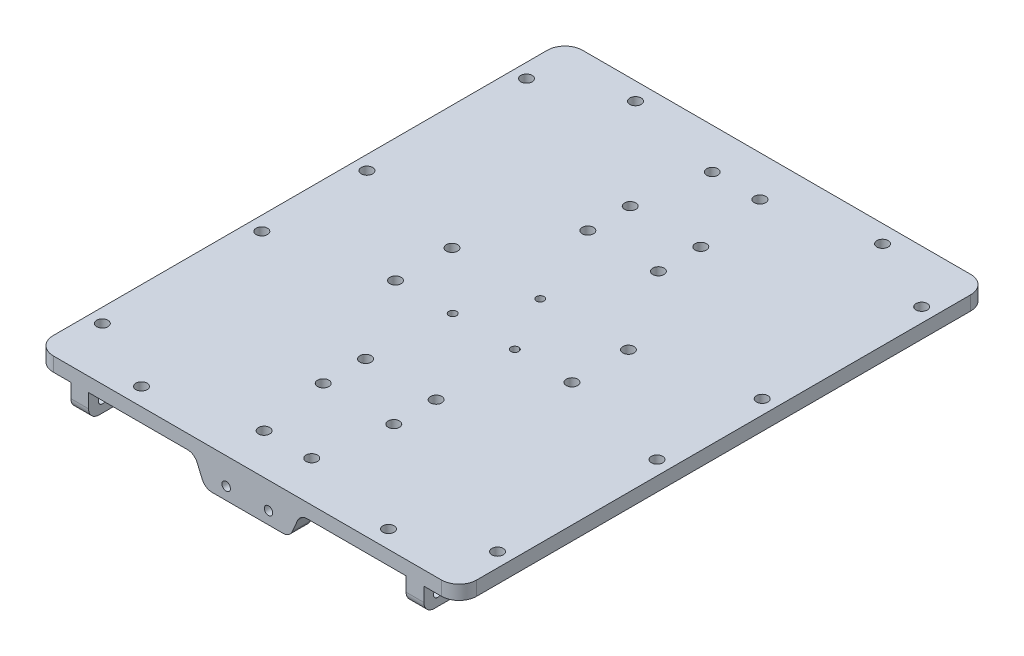
from build123d import *

# Parameters (mm, degrees)
SKETCH_1_W      = 120
SKETCH_1_H      = 150
SKETCH_1_R      = 1.6
SKETCH_1_R_2    = 1.1
EXTRUDE_1_DEPTH = 4
SKETCH_2_R      = 1.25
EXTRUDE_2_DEPTH = 5
SKETCH_3_R      = 1.2
EXTRUDE_3_DEPTH = 5
FILLET_1_R      = 5
FILLET_3_R      = 3


with BuildPart() as part:
    # 草图1 → 凸台-拉伸1 (new body)
    with BuildSketch(Plane(origin=(0, 0, 0), x_dir=(1, 0, 0), z_dir=(0, 1, 0))):
        Rectangle(SKETCH_1_W, SKETCH_1_H)
        with Locations((-56, 60.1)):
            Circle(SKETCH_1_R, mode=Mode.SUBTRACT)
        with Locations((-56, 14.9)):
            Circle(SKETCH_1_R, mode=Mode.SUBTRACT)
        with Locations((-10, 43.5)):
            Circle(SKETCH_1_R, mode=Mode.SUBTRACT)
        with Locations((-10, 31.5)):
            Circle(SKETCH_1_R, mode=Mode.SUBTRACT)
        with Locations((-56, -14.9)):
            Circle(SKETCH_1_R, mode=Mode.SUBTRACT)
        with Locations((-10, -31.5)):
            Circle(SKETCH_1_R, mode=Mode.SUBTRACT)
        with Locations((-10, -43.5)):
            Circle(SKETCH_1_R, mode=Mode.SUBTRACT)
        with Locations((-56, -60.1)):
            Circle(SKETCH_1_R, mode=Mode.SUBTRACT)
        with Locations((56, -60.1)):
            Circle(SKETCH_1_R, mode=Mode.SUBTRACT)
        with Locations((10, -43.5)):
            Circle(SKETCH_1_R, mode=Mode.SUBTRACT)
        with Locations((10, -31.5)):
            Circle(SKETCH_1_R, mode=Mode.SUBTRACT)
        with Locations((56, -14.9)):
            Circle(SKETCH_1_R, mode=Mode.SUBTRACT)
        with Locations((56, 14.9)):
            Circle(SKETCH_1_R, mode=Mode.SUBTRACT)
        with Locations((10, 31.5)):
            Circle(SKETCH_1_R, mode=Mode.SUBTRACT)
        with Locations((10, 43.5)):
            Circle(SKETCH_1_R, mode=Mode.SUBTRACT)
        with Locations((56, 60.1)):
            Circle(SKETCH_1_R, mode=Mode.SUBTRACT)
        with Locations((0, 8)):
            Circle(SKETCH_1_R_2, mode=Mode.SUBTRACT)
        with Locations((8.8, -8)):
            Circle(SKETCH_1_R_2, mode=Mode.SUBTRACT)
        with Locations((-8.8, -8)):
            Circle(SKETCH_1_R_2, mode=Mode.SUBTRACT)
        with Locations((-25, 8)):
            Circle(SKETCH_1_R, mode=Mode.SUBTRACT)
        with Locations((25, 8)):
            Circle(SKETCH_1_R, mode=Mode.SUBTRACT)
        with Locations((25, -8)):
            Circle(SKETCH_1_R, mode=Mode.SUBTRACT)
        with Locations((-25, -8)):
            Circle(SKETCH_1_R, mode=Mode.SUBTRACT)
        with Locations((35, 70)):
            Circle(SKETCH_1_R, mode=Mode.SUBTRACT)
        with Locations((-35, 70)):
            Circle(SKETCH_1_R, mode=Mode.SUBTRACT)
        with Locations((-35, -70)):
            Circle(SKETCH_1_R, mode=Mode.SUBTRACT)
        with Locations((35, -70)):
            Circle(SKETCH_1_R, mode=Mode.SUBTRACT)
        with Locations((-6.75, 63.5)):
            Circle(SKETCH_1_R, mode=Mode.SUBTRACT)
        with Locations((6.75, 63.5)):
            Circle(SKETCH_1_R, mode=Mode.SUBTRACT)
        with Locations((6.75, -63.5)):
            Circle(SKETCH_1_R, mode=Mode.SUBTRACT)
        with Locations((-6.75, -63.5)):
            Circle(SKETCH_1_R, mode=Mode.SUBTRACT)
    extrude(amount=EXTRUDE_1_DEPTH)

    # 草图2 → 凸台-拉伸2 (add)
    # profile 1 of 3: a face of its own
    with BuildSketch(Plane.ZY.offset(50)):
        Polygon((75, 0), (45, 0), (57.124355653, -7), (75, -7), align=None)
        with Locations((59, -3.5)):
            Circle(SKETCH_2_R, mode=Mode.SUBTRACT)
        with Locations((65, -3.5)):
            Circle(SKETCH_2_R, mode=Mode.SUBTRACT)
        with Locations((71, -3.5)):
            Circle(SKETCH_2_R, mode=Mode.SUBTRACT)
    # profile 2 of 3: a face of its own
    with BuildSketch(Plane.ZY.offset(50)):
        Polygon((25, 0), (-25, 0), (-17, -7), (17, -7), align=None)
    # profile 3 of 3: a face of its own
    with BuildSketch(Plane.ZY.offset(50)):
        Polygon((-45, 0), (-75, 0), (-75, -7), (-57.124355653, -7), align=None)
        with Locations((-71, -3.5)):
            Circle(SKETCH_2_R, mode=Mode.SUBTRACT)
        with Locations((-65, -3.5)):
            Circle(SKETCH_2_R, mode=Mode.SUBTRACT)
        with Locations((-59, -3.5)):
            Circle(SKETCH_2_R, mode=Mode.SUBTRACT)
    extrude_2 = extrude(amount=-EXTRUDE_2_DEPTH)

    # 镜向1: 凸台-拉伸2 across plane
    add(extrude_2.mirror(Plane.ZY))

    # 草图3 → 凸台-拉伸3 (add)
    with BuildSketch(Plane.XY.offset(75)):
        Polygon((-15, 0), (15, 0), (12, -7), (-12, -7), align=None)
        with Locations((6, -3.5)):
            Circle(SKETCH_3_R, mode=Mode.SUBTRACT)
        with Locations((-6, -3.5)):
            Circle(SKETCH_3_R, mode=Mode.SUBTRACT)
    extrude_3 = extrude(amount=-EXTRUDE_3_DEPTH)

    # 镜向2: 凸台-拉伸3 across plane
    add(extrude_3.mirror(Plane.XY))

    # 圆角1
    fillet_1_edges = [part.edges().sort_by_distance(p)[0] for p in [
        (-60, 2, -75),
        (60, 2, -75),
        (60, 2, 75),
        (-60, 2, 75),
    ]]
    fillet(fillet_1_edges, radius=FILLET_1_R)

    # 圆角3
    fillet_3_edges = [part.edges().sort_by_distance(p)[0] for p in [
        (-47.5, 0, 45),
        (-47.5, -7, 57.124355653),
        (-47.5, -7, 75),
        (47.5, -7, 75),
        (47.5, -7, 57.124355653),
        (47.5, 0, 45),
        (47.5, 0, -45),
        (-47.5, 0, -45),
        (47.5, -7, -75),
        (47.5, -7, -57.124355653),
        (-47.5, -7, -57.124355653),
        (-47.5, -7, -75),
        (-47.5, -7, 17),
        (-47.5, 0, 25),
        (-47.5, 0, -25),
        (-47.5, -7, -17),
        (47.5, 0, -25),
        (47.5, -7, -17),
        (47.5, -7, 17),
        (47.5, 0, 25),
        (-12, -7, -72.5),
        (-15, 0, -72.5),
        (12, -7, -72.5),
        (15, 0, -72.5),
        (-12, -7, 72.5),
        (-15, 0, 72.5),
        (12, -7, 72.5),
        (15, 0, 72.5),
    ]]
    fillet(fillet_3_edges, radius=FILLET_3_R)


solid = part.part
